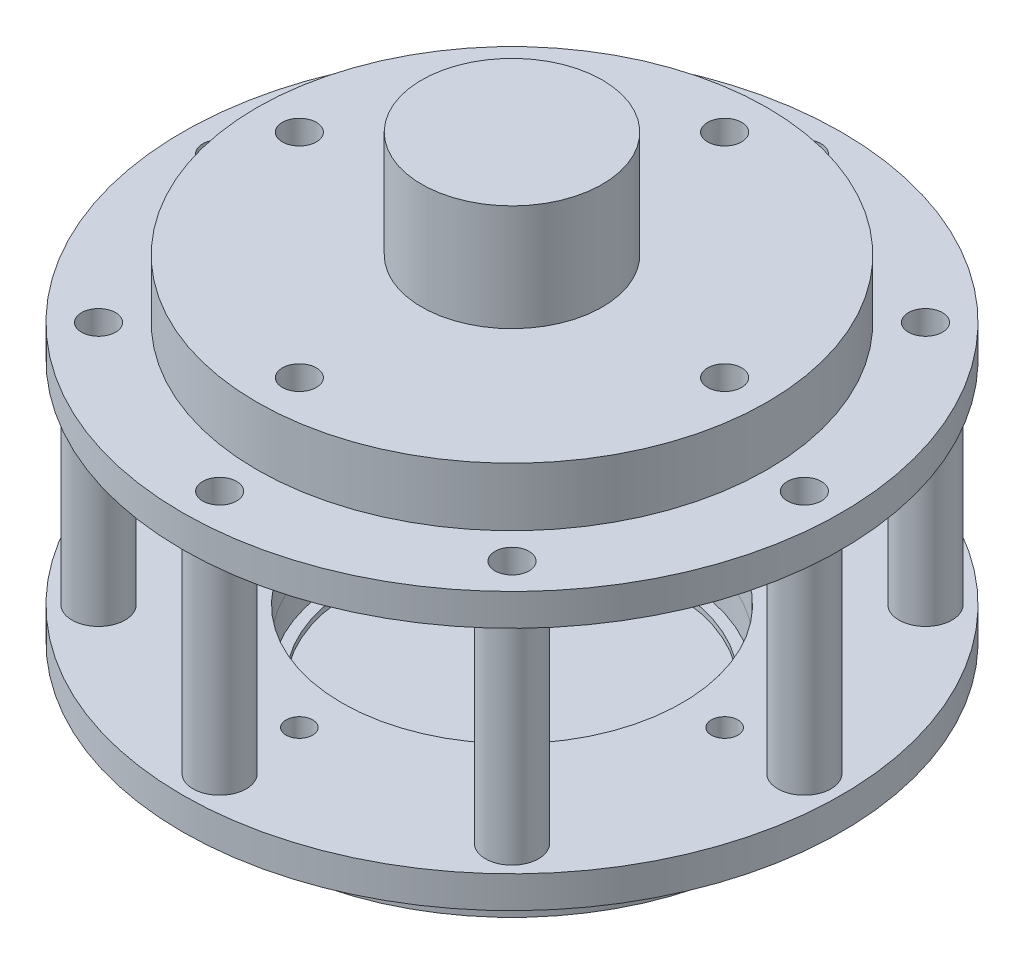
from build123d import *

# Parameters (mm, degrees)
SKETCH_1_R          = 31
SKETCH_1_R_2        = 1.6
SKETCH_1_R_3        = 16
SKETCH_1_R_4        = 1.25
EXTRUDE_1_DEPTH     = 3
SKETCH_2_R          = 2.5
CUT_EXTRUDE_1_DEPTH = 0.5
SKETCH_3_R          = 2.5
SKETCH_3_R_2        = 1.25
EXTRUDE_2_DEPTH     = 21
EXTRUDE_2_2_DEPTH   = 21
EXTRUDE_2_3_DEPTH   = 21
EXTRUDE_2_4_DEPTH   = 21
EXTRUDE_2_5_DEPTH   = 21
EXTRUDE_2_6_DEPTH   = 21
EXTRUDE_2_7_DEPTH   = 21
EXTRUDE_2_8_DEPTH   = 21
SKETCH_4_R          = 24
SKETCH_4_R_2        = 1.6
SKETCH_4_R_3        = 16
EXTRUDE_3_DEPTH     = 3
SKETCH_5_R          = 24
SKETCH_5_R_2        = 15
SKETCH_5_R_3        = 1.6
EXTRUDE_4_DEPTH     = 0.5
SKETCH_6_R          = 24
SKETCH_6_R_2        = 1.6
EXTRUDE_5_DEPTH     = 2
SKETCH_7_R          = 8.5
EXTRUDE_6_DEPTH     = 10


with BuildPart() as part:
    # ｽｹｯﾁ1 → ﾎﾞｽ - 押し出し1 (new body)
    with BuildSketch(Plane(origin=(0, 0, 0), x_dir=(1, 0, 0), z_dir=(0, 1, 0))):
        Circle(SKETCH_1_R)
        with Locations((0, 27.5)):
            Circle(SKETCH_1_R_2, mode=Mode.SUBTRACT)
        with Locations((19.445436483, 19.445436483)):
            Circle(SKETCH_1_R_2, mode=Mode.SUBTRACT)
        with Locations((27.5, 0)):
            Circle(SKETCH_1_R_2, mode=Mode.SUBTRACT)
        with Locations((19.445436483, -19.445436483)):
            Circle(SKETCH_1_R_2, mode=Mode.SUBTRACT)
        with Locations((0, -27.5)):
            Circle(SKETCH_1_R_2, mode=Mode.SUBTRACT)
        with Locations((-19.445436483, -19.445436483)):
            Circle(SKETCH_1_R_2, mode=Mode.SUBTRACT)
        with Locations((-27.5, 0)):
            Circle(SKETCH_1_R_2, mode=Mode.SUBTRACT)
        with Locations((-19.445436483, 19.445436483)):
            Circle(SKETCH_1_R_2, mode=Mode.SUBTRACT)
        Circle(SKETCH_1_R_3, mode=Mode.SUBTRACT)
        with Locations((20, 0)):
            Circle(SKETCH_1_R_4, mode=Mode.SUBTRACT)
        with Locations((0, -20)):
            Circle(SKETCH_1_R_4, mode=Mode.SUBTRACT)
        with Locations((-20, 0)):
            Circle(SKETCH_1_R_4, mode=Mode.SUBTRACT)
        with Locations((0, 20)):
            Circle(SKETCH_1_R_4, mode=Mode.SUBTRACT)
    extrude(amount=EXTRUDE_1_DEPTH)

    # ｽｹｯﾁ2 → ｶｯﾄ - 押し出し1 (cut)
    with BuildSketch(Plane(origin=(0, 3, 0), x_dir=(1, 0, 0), z_dir=(0, 1, 0))):
        with Locations((0, 27.5)):
            Circle(SKETCH_2_R)
        with Locations((19.445436483, 19.445436483)):
            Circle(SKETCH_2_R)
        with Locations((27.5, 0)):
            Circle(SKETCH_2_R)
        with Locations((19.445436483, -19.445436483)):
            Circle(SKETCH_2_R)
        with Locations((0, -27.5)):
            Circle(SKETCH_2_R)
        with Locations((-19.445436483, -19.445436483)):
            Circle(SKETCH_2_R)
        with Locations((-27.5, 0)):
            Circle(SKETCH_2_R)
        with Locations((-19.445436483, 19.445436483)):
            Circle(SKETCH_2_R)
    extrude(amount=-CUT_EXTRUDE_1_DEPTH, mode=Mode.SUBTRACT)


with BuildPart() as body_2:
    # ｽｹｯﾁ3 → ﾎﾞｽ - 押し出し2 (new body)
    with BuildSketch(Plane(origin=(0, 2.5, 0), x_dir=(1, 0, 0), z_dir=(0, 1, 0))):
        with Locations((-27.5, 0)):
            Circle(SKETCH_3_R)
        with Locations((-27.5, 0)):
            Circle(SKETCH_3_R_2, mode=Mode.SUBTRACT)
    extrude(amount=EXTRUDE_2_DEPTH)


with BuildPart() as body_3:
    # ｽｹｯﾁ3 → Extrude 2 2 (new body)
    with BuildSketch(Plane(origin=(0, 2.5, 0), x_dir=(1, 0, 0), z_dir=(0, 1, 0))):
        with Locations((-19.445436483, 19.445436483)):
            Circle(SKETCH_3_R)
        with Locations((-19.445436483, 19.445436483)):
            Circle(SKETCH_3_R_2, mode=Mode.SUBTRACT)
    extrude(amount=EXTRUDE_2_2_DEPTH)


with BuildPart() as body_4:
    # ｽｹｯﾁ3 → Extrude 2 3 (new body)
    with BuildSketch(Plane(origin=(0, 2.5, 0), x_dir=(1, 0, 0), z_dir=(0, 1, 0))):
        with Locations((0, 27.5)):
            Circle(SKETCH_3_R)
        with Locations((0, 27.5)):
            Circle(SKETCH_3_R_2, mode=Mode.SUBTRACT)
    extrude(amount=EXTRUDE_2_3_DEPTH)


with BuildPart() as body_5:
    # ｽｹｯﾁ3 → Extrude 2 4 (new body)
    with BuildSketch(Plane(origin=(0, 2.5, 0), x_dir=(1, 0, 0), z_dir=(0, 1, 0))):
        with Locations((19.445436483, 19.445436483)):
            Circle(SKETCH_3_R)
        with Locations((19.445436483, 19.445436483)):
            Circle(SKETCH_3_R_2, mode=Mode.SUBTRACT)
    extrude(amount=EXTRUDE_2_4_DEPTH)


with BuildPart() as body_6:
    # ｽｹｯﾁ3 → Extrude 2 5 (new body)
    with BuildSketch(Plane(origin=(0, 2.5, 0), x_dir=(1, 0, 0), z_dir=(0, 1, 0))):
        with Locations((27.5, 0)):
            Circle(SKETCH_3_R)
        with Locations((27.5, 0)):
            Circle(SKETCH_3_R_2, mode=Mode.SUBTRACT)
    extrude(amount=EXTRUDE_2_5_DEPTH)


with BuildPart() as body_7:
    # ｽｹｯﾁ3 → Extrude 2 6 (new body)
    with BuildSketch(Plane(origin=(0, 2.5, 0), x_dir=(1, 0, 0), z_dir=(0, 1, 0))):
        with Locations((19.445436483, -19.445436483)):
            Circle(SKETCH_3_R)
        with Locations((19.445436483, -19.445436483)):
            Circle(SKETCH_3_R_2, mode=Mode.SUBTRACT)
    extrude(amount=EXTRUDE_2_6_DEPTH)


with BuildPart() as body_8:
    # ｽｹｯﾁ3 → Extrude 2 7 (new body)
    with BuildSketch(Plane(origin=(0, 2.5, 0), x_dir=(1, 0, 0), z_dir=(0, 1, 0))):
        with Locations((0, -27.5)):
            Circle(SKETCH_3_R)
        with Locations((0, -27.5)):
            Circle(SKETCH_3_R_2, mode=Mode.SUBTRACT)
    extrude(amount=EXTRUDE_2_7_DEPTH)


with BuildPart() as body_9:
    # ｽｹｯﾁ3 → Extrude 2 8 (new body)
    with BuildSketch(Plane(origin=(0, 2.5, 0), x_dir=(1, 0, 0), z_dir=(0, 1, 0))):
        with Locations((-19.445436483, -19.445436483)):
            Circle(SKETCH_3_R)
        with Locations((-19.445436483, -19.445436483)):
            Circle(SKETCH_3_R_2, mode=Mode.SUBTRACT)
    extrude(amount=EXTRUDE_2_8_DEPTH)


with BuildPart() as body_10:
    # ｽｹｯﾁ4 → ﾎﾞｽ - 押し出し3 (new body)
    with BuildSketch(Plane.XZ):
        Circle(SKETCH_4_R)
        with Locations((20, 0)):
            Circle(SKETCH_4_R_2, mode=Mode.SUBTRACT)
        with Locations((0, -20)):
            Circle(SKETCH_4_R_2, mode=Mode.SUBTRACT)
        with Locations((-20, 0)):
            Circle(SKETCH_4_R_2, mode=Mode.SUBTRACT)
        with Locations((0, 20)):
            Circle(SKETCH_4_R_2, mode=Mode.SUBTRACT)
        Circle(SKETCH_4_R_3, mode=Mode.SUBTRACT)
    extrude(amount=EXTRUDE_3_DEPTH)


with BuildPart() as body_11:
    # ｽｹｯﾁ5 → ﾎﾞｽ - 押し出し4 (new body)
    with BuildSketch(Plane.XZ.offset(3)):
        Circle(SKETCH_5_R)
        Circle(SKETCH_5_R_2, mode=Mode.SUBTRACT)
        with Locations((20, 0)):
            Circle(SKETCH_5_R_3, mode=Mode.SUBTRACT)
        with Locations((0, -20)):
            Circle(SKETCH_5_R_3, mode=Mode.SUBTRACT)
        with Locations((-20, 0)):
            Circle(SKETCH_5_R_3, mode=Mode.SUBTRACT)
        with Locations((0, 20)):
            Circle(SKETCH_5_R_3, mode=Mode.SUBTRACT)
    extrude(amount=EXTRUDE_4_DEPTH)


with BuildPart() as body_12:
    # ｽｹｯﾁ6 → ﾎﾞｽ - 押し出し5 (new body)
    with BuildSketch(Plane.XZ.offset(3.5)):
        Circle(SKETCH_6_R)
        with Locations((0, 20)):
            Circle(SKETCH_6_R_2, mode=Mode.SUBTRACT)
        with Locations((20, 0)):
            Circle(SKETCH_6_R_2, mode=Mode.SUBTRACT)
        with Locations((0, -20)):
            Circle(SKETCH_6_R_2, mode=Mode.SUBTRACT)
        with Locations((-20, 0)):
            Circle(SKETCH_6_R_2, mode=Mode.SUBTRACT)
    extrude(amount=EXTRUDE_5_DEPTH)

    # Combine 1: union body 11, body 10
    add(body_11.part)
    add(body_10.part)


with BuildPart() as body_13:
    # ｽｹｯﾁ7 → ﾎﾞｽ - 押し出し6 (new body)
    with BuildSketch(Plane.XZ.offset(5.5)):
        Circle(SKETCH_7_R)
    extrude(amount=EXTRUDE_6_DEPTH)


with BuildPart() as body_14:
    # ﾐﾗｰ1: mirrored copy
    add(part.part.mirror(Plane.ZX.offset(13)))


with BuildPart() as body_13_2:
    # ﾐﾗｰ2: mirrored copy
    add(body_12.part.mirror(Plane.ZX.offset(13)))


with BuildPart() as body_14_2:
    # Mirror 2 2: mirrored copy
    add(body_13.part.mirror(Plane.ZX.offset(13)))


solid = Compound([part.part, body_2.part, body_3.part, body_4.part, body_5.part, body_6.part, body_7.part, body_8.part, body_9.part, body_12.part, body_13.part, body_14.part, body_13_2.part, body_14_2.part])
